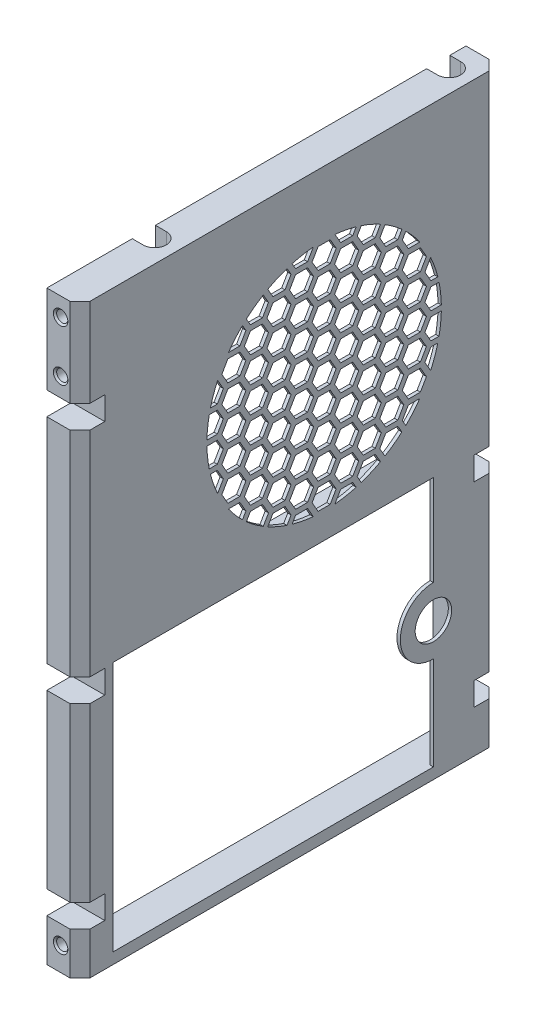
from build123d import *

# Parameters (mm, degrees)
BOSS_EXTRUDE1_START                    = -10.16
SKETCH3_W                              = 160.866666667
SKETCH3_H                              = 224.925000831
SKETCH3_W_2                            = 143.721666667
SKETCH3_H_2                            = 100.635
SKETCH3_W_3                            = 135.466666667
SKETCH3_H_3                            = 96.215000042
BOSS_EXTRUDE1_DEPTH                    = 12.7
BOSS_EXTRUDE4_DEPTH                    = 1.27
SCREWDRIVER_ACCESS_HOLES_DEPTH         = 16.433334164
F_24_0_152_DIAMETER_HOLE1_D            = 3.8608
F_24_0_152_DIAMETER_HOLE1_DEPTH        = 19.608334164
CUT_EXTRUDE6_REACH                     = 183.847
FILL_START                             = 1.27
FILL_PATTERN1_DEPTH                    = 1.27
SKETCH29_W                             = 160.866666667
SKETCH29_H                             = 124.476667455
SKETCH29_R                             = 45
BOSS_EXTRUDE5_DEPTH                    = 1.27
CUT_EXTRUDE5_REACH                     = 183.847
SKETCH23_R                             = 6.99999997
REAR_PINS_DEPTH                        = 5.08
BOTTOM_PINS_DEPTH                      = 6.35
CHAMFER3_SIZE                          = 0.635
F_18_0_1695_DIAMETER_HOLE1_D           = 4.3053
F_18_0_1695_DIAMETER_HOLE1_DEPTH       = 8.382
F_18_0_1695_DIAMETER_HOLE1_CSINK_D     = 5.5753
F_18_0_1695_DIAMETER_HOLE1_CSINK_ANGLE = 90
F_18_0_1695_DIAMETER_HOLE1_TIP         = 1.293442612
CHAMFER4_SIZE                          = 3.81
SKETCH34_W                             = 9.525
SKETCH34_H                             = 8.89
CUT_EXTRUDE7_DEPTH                     = 182.846934885


# Read off the part's stored shape, not the designer's step: Fill Pattern1, #18 (0.1695) Diameter Hole2
with BuildPart() as part:
    # Sketch3 → Boss-Extrude1 (new body)
    with BuildSketch(Plane(origin=(0, 0, 0), x_dir=(0, 0, -1), z_dir=(1, 0, 0)).offset(BOSS_EXTRUDE1_START)):
        with Locations((-13.288333225, -42.854166252)):
            Rectangle(SKETCH3_W, SKETCH3_H)
        with Locations((-9.160833226, -0.3175)):
            Rectangle(SKETCH3_W_2, SKETCH3_H_2, mode=Mode.SUBTRACT)
        with Locations((-13.288333226, -102.975833312)):
            Rectangle(SKETCH3_W_3, SKETCH3_H_3, mode=Mode.SUBTRACT)
    extrude(amount=BOSS_EXTRUDE1_DEPTH)

    # Sketch12 → Boss-Extrude4 (add)
    with BuildSketch(Plane(origin=(2.54, 0, 0), x_dir=(0, 0, -1), z_dir=(1, 0, 0))):
        with BuildLine():
            Line((-81.021666559, 50), (62.5, 50))
            Line((62.5, 50), (62.5, -151.083333333))
            Line((62.5, -151.083333333), (41.945000089, -151.083333333))
            Line((41.945000089, -151.083333333), (41.945000089, -115.176668489))
            ThreePointArc((41.945000089, -115.176668489), (29.245000089, -102.476668489), (41.945000089, -89.776668489))
            Line((41.945000089, -89.776668489), (41.945000089, -50.635))
            Line((41.945000089, -50.635), (-81.021666559, -50.635))
            Line((-81.021666559, -50.635), (-81.021666559, 50))
        make_face()
    extrude(amount=-BOSS_EXTRUDE4_DEPTH)

    # Sketch16 → screwdriver access holes (cut)
    with BuildSketch(Plane(origin=(0, 69.608334164, 0), x_dir=(1, 0, 0), z_dir=(0, 1, 0))):
        with BuildLine():
            Line((-6, 60.945), (-10.16, 60.945))
            Line((-10.16, 60.945), (-10.16, 52.055))
            Line((-10.16, 52.055), (-6, 52.055))
            ThreePointArc((-6, 52.055), (-1.555, 56.5), (-6, 60.945))
        make_face()
        with BuildLine():
            Line((-6, -52.055), (-10.16, -52.055))
            Line((-10.16, -52.055), (-10.16, -60.945))
            Line((-10.16, -60.945), (-6, -60.945))
            ThreePointArc((-6, -60.945), (-1.555, -56.5), (-6, -52.055))
        make_face()
    extrude(amount=-SCREWDRIVER_ACCESS_HOLES_DEPTH, mode=Mode.SUBTRACT)

    # #24 (0.152) Diameter Hole1
    with Locations(Plane(origin=(0, 69.608334164, 0), x_dir=(1, 0, 0), z_dir=(0, 1, 0))):
        with Locations((-6, 56.5), (-6, -56.5)):
            Hole(F_24_0_152_DIAMETER_HOLE1_D / 2, depth=F_24_0_152_DIAMETER_HOLE1_DEPTH)

    # Sketch28 → Cut-Extrude6 (cut, up to next)
    with BuildSketch(Plane(origin=(2.54, 0, 0), x_dir=(0, 0, -1), z_dir=(1, 0, 0)), mode=Mode.PRIVATE) as cut_extrude6_sk1:
        Polygon((4.618802154, 0), (2.309401077, 4), (-2.309401077, 4), (-4.618802154, 0), (-2.309401077, -4), (2.309401077, -4), align=None)
    cut_extrude6_tool1 = extrude(cut_extrude6_sk1.sketch, amount=-CUT_EXTRUDE6_REACH, mode=Mode.PRIVATE) & part.part
    add(cut_extrude6_tool1.solids().sort_by_distance((2.54, 0, 0))[0], mode=Mode.SUBTRACT)

    # Fill Pattern1 outline → Fill Pattern1 (cut)
    with BuildSketch(Plane.YZ.offset(FILL_START)):
        Polygon((26, -15.011106999), (26, -19.629909152), (30, -21.939310229), (34, -19.629909152), (34, -15.011106999), (30, -12.701705922), align=None)
        Polygon((-19, 10.969655115), (-19, 6.350852961), (-15, 4.041451884), (-11, 6.350852961), (-11, 10.969655115), (-15, 13.279056191), align=None)
        Polygon((-34, 19.629909152), (-34, 15.011106999), (-30, 12.701705922), (-26, 15.011106999), (-26, 19.629909152), (-30, 21.939310229), align=None)
        Polygon((11, -6.350852961), (11, -10.969655115), (15, -13.279056191), (19, -10.969655115), (19, -6.350852961), (15, -4.041451884), align=None)
        Polygon((0, 39.259818305), (-4, 36.950417228), (-4, 32.331615075), (0, 30.022213998), (4, 32.331615075), (4, 36.950417228), align=None)
        Polygon((0, -12.701705922), (-4, -15.011106999), (-4, -19.629909152), (0, -21.939310229), (4, -19.629909152), (4, -15.011106999), align=None)
        Polygon((0, -30.022213998), (-4, -32.331615075), (-4, -36.950417228), (0, -39.259818305), (4, -36.950417228), (4, -32.331615075), align=None)
        Polygon((0, 21.939310229), (-4, 19.629909152), (-4, 15.011106999), (0, 12.701705922), (4, 15.011106999), (4, 19.629909152), align=None)
        Polygon((-26, -15.011106999), (-30, -12.701705922), (-34, -15.011106999), (-34, -19.629909152), (-30, -21.939310229), (-26, -19.629909152), align=None)
        Polygon((-11, -6.350852961), (-15, -4.041451884), (-19, -6.350852961), (-19, -10.969655115), (-15, -13.279056191), (-11, -10.969655115), align=None)
        Polygon((19, 10.969655115), (15, 13.279056191), (11, 10.969655115), (11, 6.350852961), (15, 4.041451884), (19, 6.350852961), align=None)
        Polygon((34, 19.629909152), (30, 21.939310229), (26, 19.629909152), (26, 15.011106999), (30, 12.701705922), (34, 15.011106999), align=None)
        Polygon((-19, -40.991869112), (-19, -45.610671266), (-15, -47.920072343), (-11, -45.610671266), (-11, -40.991869112), (-15, -38.682468036), align=None)
        Polygon((-34, -32.331615075), (-34, -36.950417228), (-30, -39.259818305), (-26, -36.950417228), (-26, -32.331615075), (-30, -30.022213998), align=None)
        Polygon((-15, 47.920072343), (-19, 45.610671266), (-19, 40.991869112), (-15, 38.682468036), (-11, 40.991869112), (-11, 45.610671266), align=None)
        Polygon((-15, 30.599564267), (-19, 28.29016319), (-19, 23.671361037), (-15, 21.36195996), (-11, 23.671361037), (-11, 28.29016319), align=None)
        Polygon((-15, -21.36195996), (-19, -23.671361037), (-19, -28.29016319), (-15, -30.599564267), (-11, -28.29016319), (-11, -23.671361037), align=None)
        Polygon((19, -23.671361037), (15, -21.36195996), (11, -23.671361037), (11, -28.29016319), (15, -30.599564267), (19, -28.29016319), align=None)
        Polygon((49, -6.350852961), (45, -4.041451884), (41, -6.350852961), (41, -10.969655115), (45, -13.279056191), (49, -10.969655115), align=None)
        Polygon((-34, 36.950417228), (-34, 32.331615075), (-30, 30.022213998), (-26, 32.331615075), (-26, 36.950417228), (-30, 39.259818305), align=None)
        Polygon((26, 2.309401077), (26, -2.309401077), (30, -4.618802154), (34, -2.309401077), (34, 2.309401077), (30, 4.618802154), align=None)
        Polygon((-30, 4.618802154), (-34, 2.309401077), (-34, -2.309401077), (-30, -4.618802154), (-26, -2.309401077), (-26, 2.309401077), align=None)
        Polygon((-24, 36.950417228), (-24, 32.331615075), (-20, 30.022213998), (-16, 32.331615075), (-16, 36.950417228), (-20, 39.259818305), align=None)
        Polygon((-9, 28.29016319), (-9, 23.671361037), (-5, 21.36195996), (-1, 23.671361037), (-1, 28.29016319), (-5, 30.599564267), align=None)
        Polygon((21, 10.969655115), (21, 6.350852961), (25, 4.041451884), (29, 6.350852961), (29, 10.969655115), (25, 13.279056191), align=None)
        Polygon((6, 19.629909152), (6, 15.011106999), (10, 12.701705922), (14, 15.011106999), (14, 19.629909152), (10, 21.939310229), align=None)
        Polygon((36, 2.309401077), (36, -2.309401077), (40, -4.618802154), (44, -2.309401077), (44, 2.309401077), (40, 4.618802154), align=None)
        Polygon((-20, -12.701705922), (-24, -15.011106999), (-24, -19.629909152), (-20, -21.939310229), (-16, -19.629909152), (-16, -15.011106999), align=None)
        Polygon((-20, -30.022213998), (-24, -32.331615075), (-24, -36.950417228), (-20, -39.259818305), (-16, -36.950417228), (-16, -32.331615075), align=None)
        Polygon((-20, 21.939310229), (-24, 19.629909152), (-24, 15.011106999), (-20, 12.701705922), (-16, 15.011106999), (-16, 19.629909152), align=None)
        Polygon((-20, 4.618802154), (-24, 2.309401077), (-24, -2.309401077), (-20, -4.618802154), (-16, -2.309401077), (-16, 2.309401077), align=None)
        Polygon((-31, 28.29016319), (-35, 30.599564267), (-39, 28.29016319), (-39, 23.671361037), (-35, 21.36195996), (-31, 23.671361037), align=None)
        Polygon((-1, 45.610671266), (-5, 47.920072343), (-9, 45.610671266), (-9, 40.991869112), (-5, 38.682468036), (-1, 40.991869112), align=None)
        Polygon((-14, 36.950417228), (-14, 32.331615075), (-10, 30.022213998), (-6, 32.331615075), (-6, 36.950417228), (-10, 39.259818305), align=None)
        Polygon((1, 28.29016319), (1, 23.671361037), (5, 21.36195996), (9, 23.671361037), (9, 28.29016319), (5, 30.599564267), align=None)
        Polygon((31, 10.969655115), (31, 6.350852961), (35, 4.041451884), (39, 6.350852961), (39, 10.969655115), (35, 13.279056191), align=None)
        Polygon((16, 19.629909152), (16, 15.011106999), (20, 12.701705922), (24, 15.011106999), (24, 19.629909152), (20, 21.939310229), align=None)
        Polygon((-10, -12.701705922), (-14, -15.011106999), (-14, -19.629909152), (-10, -21.939310229), (-6, -19.629909152), (-6, -15.011106999), align=None)
        Polygon((-10, -30.022213998), (-14, -32.331615075), (-14, -36.950417228), (-10, -39.259818305), (-6, -36.950417228), (-6, -32.331615075), align=None)
        Polygon((-10, 21.939310229), (-14, 19.629909152), (-14, 15.011106999), (-10, 12.701705922), (-6, 15.011106999), (-6, 19.629909152), align=None)
        Polygon((-10, 4.618802154), (-14, 2.309401077), (-14, -2.309401077), (-10, -4.618802154), (-6, -2.309401077), (-6, 2.309401077), align=None)
        Polygon((-21, 28.29016319), (-25, 30.599564267), (-29, 28.29016319), (-29, 23.671361037), (-25, 21.36195996), (-21, 23.671361037), align=None)
        Polygon((9, 45.610671266), (5, 47.920072343), (1, 45.610671266), (1, 40.991869112), (5, 38.682468036), (9, 40.991869112), align=None)
        Polygon((-36, 19.629909152), (-40, 21.939310229), (-44, 19.629909152), (-44, 15.011106999), (-40, 12.701705922), (-36, 15.011106999), align=None)
        Polygon((11, 28.29016319), (11, 23.671361037), (15, 21.36195996), (19, 23.671361037), (19, 28.29016319), (15, 30.599564267), align=None)
        Polygon((41, 10.969655115), (41, 6.350852961), (45, 4.041451884), (49, 6.350852961), (49, 10.969655115), (45, 13.279056191), align=None)
        Polygon((19, 45.610671266), (15, 47.920072343), (11, 45.610671266), (11, 40.991869112), (15, 38.682468036), (19, 40.991869112), align=None)
        Polygon((-41, 10.969655115), (-45, 13.279056191), (-49, 10.969655115), (-49, 6.350852961), (-45, 4.041451884), (-41, 6.350852961), align=None)
        Polygon((26, 36.950417228), (26, 32.331615075), (30, 30.022213998), (34, 32.331615075), (34, 36.950417228), (30, 39.259818305), align=None)
        Polygon((30, -30.022213998), (26, -32.331615075), (26, -36.950417228), (30, -39.259818305), (34, -36.950417228), (34, -32.331615075), align=None)
        Polygon((-41, -6.350852961), (-45, -4.041451884), (-49, -6.350852961), (-49, -10.969655115), (-45, -13.279056191), (-41, -10.969655115), align=None)
        Polygon((16, 36.950417228), (16, 32.331615075), (20, 30.022213998), (24, 32.331615075), (24, 36.950417228), (20, 39.259818305), align=None)
        Polygon((31, 28.29016319), (31, 23.671361037), (35, 21.36195996), (39, 23.671361037), (39, 28.29016319), (35, 30.599564267), align=None)
        Polygon((20, -12.701705922), (16, -15.011106999), (16, -19.629909152), (20, -21.939310229), (24, -19.629909152), (24, -15.011106999), align=None)
        Polygon((20, -30.022213998), (16, -32.331615075), (16, -36.950417228), (20, -39.259818305), (24, -36.950417228), (24, -32.331615075), align=None)
        Polygon((20, 4.618802154), (16, 2.309401077), (16, -2.309401077), (20, -4.618802154), (24, -2.309401077), (24, 2.309401077), align=None)
        Polygon((-36, 2.309401077), (-40, 4.618802154), (-44, 2.309401077), (-44, -2.309401077), (-40, -4.618802154), (-36, -2.309401077), align=None)
        Polygon((-21, 10.969655115), (-25, 13.279056191), (-29, 10.969655115), (-29, 6.350852961), (-25, 4.041451884), (-21, 6.350852961), align=None)
        Polygon((6, 36.950417228), (6, 32.331615075), (10, 30.022213998), (14, 32.331615075), (14, 36.950417228), (10, 39.259818305), align=None)
        Polygon((21, 28.29016319), (21, 23.671361037), (25, 21.36195996), (29, 23.671361037), (29, 28.29016319), (25, 30.599564267), align=None)
        Polygon((36, 19.629909152), (36, 15.011106999), (40, 12.701705922), (44, 15.011106999), (44, 19.629909152), (40, 21.939310229), align=None)
        Polygon((10, -12.701705922), (6, -15.011106999), (6, -19.629909152), (10, -21.939310229), (14, -19.629909152), (14, -15.011106999), align=None)
        Polygon((10, -30.022213998), (6, -32.331615075), (6, -36.950417228), (10, -39.259818305), (14, -36.950417228), (14, -32.331615075), align=None)
        Polygon((10, 4.618802154), (6, 2.309401077), (6, -2.309401077), (10, -4.618802154), (14, -2.309401077), (14, 2.309401077), align=None)
        Polygon((-31, 10.969655115), (-35, 13.279056191), (-39, 10.969655115), (-39, 6.350852961), (-35, 4.041451884), (-31, 6.350852961), align=None)
        Polygon((35, -21.36195996), (31, -23.671361037), (31, -28.29016319), (35, -30.599564267), (39, -28.29016319), (39, -23.671361037), align=None)
        Polygon((35, -4.041451884), (31, -6.350852961), (31, -10.969655115), (35, -13.279056191), (39, -10.969655115), (39, -6.350852961), align=None)
        Polygon((-36, -15.011106999), (-40, -12.701705922), (-44, -15.011106999), (-44, -19.629909152), (-40, -21.939310229), (-36, -19.629909152), align=None)
        Polygon((-21, -6.350852961), (-25, -4.041451884), (-29, -6.350852961), (-29, -10.969655115), (-25, -13.279056191), (-21, -10.969655115), align=None)
        Polygon((9, 10.969655115), (5, 13.279056191), (1, 10.969655115), (1, 6.350852961), (5, 4.041451884), (9, 6.350852961), align=None)
        Polygon((25, -21.36195996), (21, -23.671361037), (21, -28.29016319), (25, -30.599564267), (29, -28.29016319), (29, -23.671361037), align=None)
        Polygon((25, -4.041451884), (21, -6.350852961), (21, -10.969655115), (25, -13.279056191), (29, -10.969655115), (29, -6.350852961), align=None)
        Polygon((-31, -6.350852961), (-35, -4.041451884), (-39, -6.350852961), (-39, -10.969655115), (-35, -13.279056191), (-31, -10.969655115), align=None)
        Polygon((-1, 10.969655115), (-5, 13.279056191), (-9, 10.969655115), (-9, 6.350852961), (-5, 4.041451884), (-1, 6.350852961), align=None)
        Polygon((15, -38.682468036), (11, -40.991869112), (11, -45.610671266), (15, -47.920072343), (19, -45.610671266), (19, -40.991869112), align=None)
        Polygon((5, -38.682468036), (1, -40.991869112), (1, -45.610671266), (5, -47.920072343), (9, -45.610671266), (9, -40.991869112), align=None)
        Polygon((5, -21.36195996), (1, -23.671361037), (1, -28.29016319), (5, -30.599564267), (9, -28.29016319), (9, -23.671361037), align=None)
        Polygon((5, -4.041451884), (1, -6.350852961), (1, -10.969655115), (5, -13.279056191), (9, -10.969655115), (9, -6.350852961), align=None)
        Polygon((-5, -4.041451884), (-9, -6.350852961), (-9, -10.969655115), (-5, -13.279056191), (-1, -10.969655115), (-1, -6.350852961), align=None)
        Polygon((-5, -38.682468036), (-9, -40.991869112), (-9, -45.610671266), (-5, -47.920072343), (-1, -45.610671266), (-1, -40.991869112), align=None)
        Polygon((-5, -21.36195996), (-9, -23.671361037), (-9, -28.29016319), (-5, -30.599564267), (-1, -28.29016319), (-1, -23.671361037), align=None)
        Polygon((-25, -21.36195996), (-29, -23.671361037), (-29, -28.29016319), (-25, -30.599564267), (-21, -28.29016319), (-21, -23.671361037), align=None)
        Polygon((36, -15.011106999), (36, -19.629909152), (40, -21.939310229), (44, -19.629909152), (44, -15.011106999), (40, -12.701705922), align=None)
        Polygon((-35, -21.36195996), (-39, -23.671361037), (-39, -28.29016319), (-35, -30.599564267), (-31, -28.29016319), (-31, -23.671361037), align=None)
    extrude(amount=FILL_PATTERN1_DEPTH, mode=Mode.SUBTRACT)

    # Sketch29 → Boss-Extrude5 (add)
    with BuildSketch(Plane(origin=(2.54, 0, 0), x_dir=(0, 0, -1), z_dir=(1, 0, 0))):
        with Locations((-13.288333225, 7.370000436)):
            Rectangle(SKETCH29_W, SKETCH29_H)
        Circle(SKETCH29_R, mode=Mode.SUBTRACT)
    extrude(amount=-BOSS_EXTRUDE5_DEPTH)

    # Sketch23 → Cut-Extrude5 (cut, up to next)
    with BuildSketch(Plane(origin=(2.54, 0, 0), x_dir=(0, 0, -1), z_dir=(1, 0, 0)), mode=Mode.PRIVATE) as cut_extrude5_sk1:
        with Locations((41.945000089, -102.476668489)):
            Circle(SKETCH23_R)
    cut_extrude5_tool1 = extrude(cut_extrude5_sk1.sketch, amount=-CUT_EXTRUDE5_REACH, mode=Mode.PRIVATE) & part.part
    add(cut_extrude5_tool1.solids().sort_by_distance((2.54, -102.476668, -41.945))[0], mode=Mode.SUBTRACT)

    # Sketch6 → rear pins (cut)
    with BuildSketch(Plane(origin=(-10.16, 0, 0), x_dir=(0, 0, -1), z_dir=(1, 0, 0))):
        Polygon((-68.6383552, 65.375000831), (-65.4633552, 68.550000831), (-62.2883552, 65.375000831), (-65.4633552, 62.200000831), align=None)
        Polygon((-62.2883552, 54.233333333), (-65.4633552, 57.408333333), (-68.6383552, 54.233333333), (-65.4633552, 51.058333333), align=None)
        Polygon((-92.663333225, 54.233333333), (-89.488333225, 57.408333333), (-86.313333225, 54.233333333), (-89.488333225, 51.058333333), align=None)
    extrude(amount=REAR_PINS_DEPTH, mode=Mode.SUBTRACT)

    # Sketch25 → bottom pins (cut)
    with BuildSketch(Plane.XZ.offset(155.316666667)):
        Polygon((-3.81, 86.313333225), (-6.985, 89.488333225), (-3.81, 92.663333225), (-0.635, 89.488333225), align=None)
        Polygon((-6.985, -62.911666775), (-3.81, -59.736666775), (-0.635, -62.911666775), (-3.81, -66.086666775), align=None)
    extrude(amount=-BOTTOM_PINS_DEPTH, mode=Mode.SUBTRACT)

    # Chamfer3
    chamfer3_edges = [part.edges().sort_by_distance(p)[0] for p in [
        (-10.16, 52.645833333, 91.075833225),
        (-10.16, 52.645833333, 87.900833225),
        (-10.16, 55.820833333, 87.900833225),
        (-10.16, 55.820833333, 91.075833225),
        (-5.08, 52.645833333, 91.075833225),
        (-5.08, 52.645833333, 87.900833225),
        (-5.08, 55.820833333, 87.900833225),
        (-5.08, 55.820833333, 91.075833225),
        (-10.16, 63.787500831, 67.0508552),
        (-10.16, 63.787500831, 63.8758552),
        (-10.16, 66.962500831, 63.8758552),
        (-10.16, 66.962500831, 67.0508552),
        (-5.08, 63.787500831, 67.0508552),
        (-5.08, 63.787500831, 63.8758552),
        (-5.08, 66.962500831, 63.8758552),
        (-5.08, 66.962500831, 67.0508552),
        (-10.16, 52.645833333, 63.8758552),
        (-10.16, 55.820833333, 63.8758552),
        (-10.16, 55.820833333, 67.0508552),
        (-10.16, 52.645833333, 67.0508552),
        (-5.08, 52.645833333, 63.8758552),
        (-5.08, 55.820833333, 63.8758552),
        (-5.08, 55.820833333, 67.0508552),
        (-5.08, 52.645833333, 67.0508552),
        (-2.2225, -148.966666667, 87.900833225),
        (-5.3975, -148.966666667, 87.900833225),
        (-5.3975, -148.966666667, 91.075833225),
        (-2.2225, -148.966666667, 91.075833225),
        (-2.2225, -155.316666667, 87.900833225),
        (-2.2225, -155.316666667, 91.075833225),
        (-5.3975, -155.316666667, 91.075833225),
        (-5.3975, -155.316666667, 87.900833225),
        (-5.3975, -148.966666667, -64.499166775),
        (-5.3975, -148.966666667, -61.324166775),
        (-2.2225, -148.966666667, -61.324166775),
        (-2.2225, -148.966666667, -64.499166775),
        (-5.3975, -155.316666667, -64.499166775),
        (-2.2225, -155.316666667, -64.499166775),
        (-2.2225, -155.316666667, -61.324166775),
        (-5.3975, -155.316666667, -61.324166775),
    ]]
    chamfer(chamfer3_edges, length=CHAMFER3_SIZE)

    # #18 (0.1695) Diameter Hole1
    with Locations(Plane(origin=(0, 0, -67.145000108), x_dir=(-1, 0, 0), z_dir=(0, 0, -1))):
        with Locations((4.88, -146.291666667), (4.88, 62.488333333), (4.88, 42.938333317)):
            CounterSinkHole(F_18_0_1695_DIAMETER_HOLE1_D / 2, F_18_0_1695_DIAMETER_HOLE1_CSINK_D / 2, depth=F_18_0_1695_DIAMETER_HOLE1_DEPTH, counter_sink_angle=F_18_0_1695_DIAMETER_HOLE1_CSINK_ANGLE)
            with Locations((0, 0, -(F_18_0_1695_DIAMETER_HOLE1_DEPTH + F_18_0_1695_DIAMETER_HOLE1_TIP / 2))):  # 118° drill point
                Cone(0, F_18_0_1695_DIAMETER_HOLE1_D / 2, F_18_0_1695_DIAMETER_HOLE1_TIP, mode=Mode.SUBTRACT)

    # #18 (0.1695) Diameter Hole2 outline → #18 (0.1695) Diameter Hole2 (revolve, cut)
    with BuildSketch(Plane(origin=(-4.88, 42.938333317, 0), x_dir=(1, 0, 0), z_dir=(0, -1, 0))):
        Polygon((0, 83.961565747), (2.15265, 85.255008359), (2.15265, 93.086666559), (2.78765, 93.721666559), (0, 93.721666559), align=None)
    revolve(axis=Axis((-4.88, 42.938333317, 0), (0, 0, 1)), mode=Mode.SUBTRACT)

    # 18 _0.1695_ Diameter Hole2 2 outline → 18 _0.1695_ Diameter Hole2 2 (revolve, cut)
    with BuildSketch(Plane(origin=(-4.88, 62.488333333, 0), x_dir=(1, 0, 0), z_dir=(0, -1, 0))):
        Polygon((0, 83.961565747), (2.15265, 85.255008359), (2.15265, 93.086666559), (2.78765, 93.721666559), (0, 93.721666559), align=None)
    revolve(axis=Axis((-4.88, 62.488333333, 0), (0, 0, 1)), mode=Mode.SUBTRACT)

    # 18 _0.1695_ Diameter Hole2 3 outline → 18 _0.1695_ Diameter Hole2 3 (revolve, cut)
    with BuildSketch(Plane(origin=(-4.88, -146.291666667, 0), x_dir=(1, 0, 0), z_dir=(0, -1, 0))):
        Polygon((0, 83.961565747), (2.15265, 85.255008359), (2.15265, 93.086666559), (2.78765, 93.721666559), (0, 93.721666559), align=None)
    revolve(axis=Axis((-4.88, -146.291666667, 0), (0, 0, 1)), mode=Mode.SUBTRACT)

    # Chamfer4
    chamfer4_edges = [part.edges().sort_by_distance(p)[0] for p in [
        (2.54, -42.854166251, 93.721666559),
        (2.54, -42.854166251, -67.145000108),
    ]]
    chamfer(chamfer4_edges, length=CHAMFER4_SIZE)

    # Sketch34 → Cut-Extrude7 (cut, through all)
    with BuildSketch(Plane.ZY.offset(10.16)):
        with Locations((-62.382500108, -59.685666667)):
            Rectangle(SKETCH34_W, SKETCH34_H)
        with Locations((-62.382500108, -134.615666667)):
            Rectangle(SKETCH34_W, SKETCH34_H)
        with Locations((88.959166559, -134.615666667)):
            Rectangle(SKETCH34_W, SKETCH34_H)
        with Locations((88.959166559, -59.685666667)):
            Rectangle(SKETCH34_W, SKETCH34_H)
        with Locations((88.959166559, 31.246333333)):
            Rectangle(SKETCH34_W, SKETCH34_H)
    extrude(amount=-CUT_EXTRUDE7_DEPTH, mode=Mode.SUBTRACT)


solid = part.part
